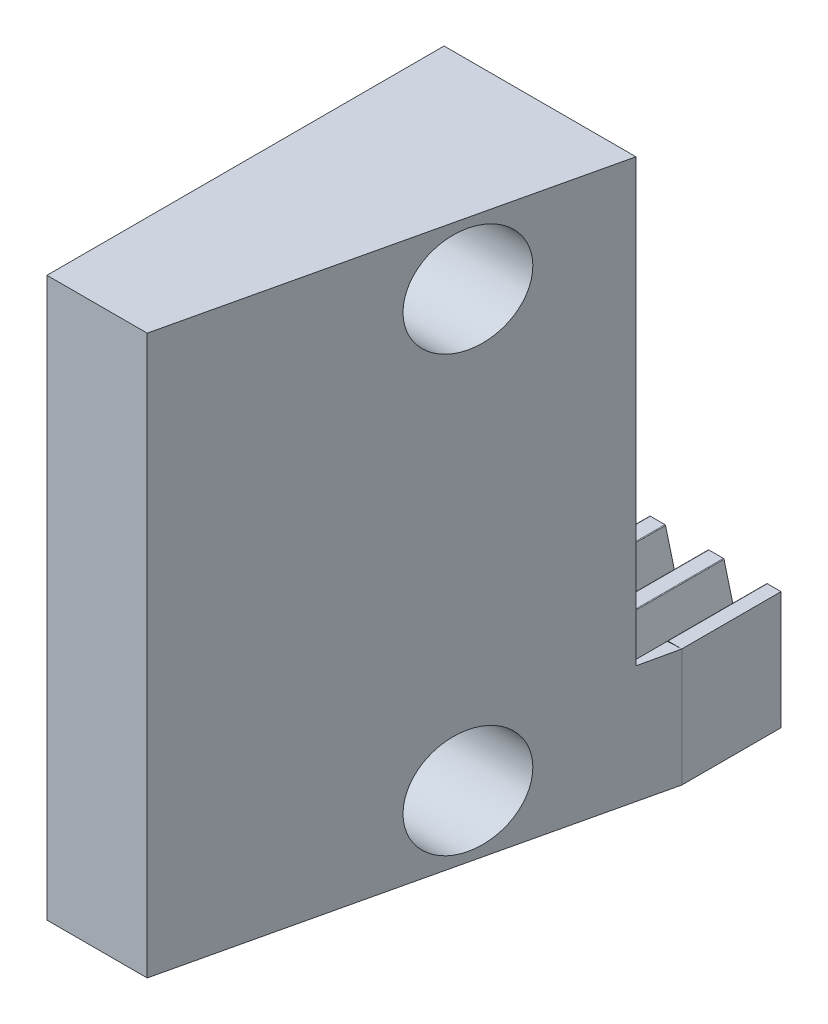
from build123d import *

# Parameters (mm, degrees)
BLANKSKE_W          = 50
BLANKSKE_H          = 9.5
BLANK_DEPTH         = 8
TOOTHCUTILL_DEPTH   = 52.519413817
TOOTHCUTSIM_DEPTH   = 52.519413817
TEETHCUTS_COUNT     = 12
TEETHCUTS_PITCH     = 4.712388975
BOSS_EXTRUDE8_DEPTH = 45
CUT_EXTRUDE5_DEPTH  = 3
SKETCH20_R          = 4.25
CUT_EXTRUDE6_DEPTH  = 25


with BuildPart() as part:
    # BlankSke → Blank (new body)
    with BuildSketch(Plane.XY):
        with Locations((25, 4.75)):
            Rectangle(BLANKSKE_W, BLANKSKE_H)
    extrude(amount=-BLANK_DEPTH)

    # TooCutSkeIll → ToothCutIll (cut, through all)
    with BuildSketch(Plane.XY):
        with BuildLine():
            Line((-1.713391726, 9.4550228), (-0.92508248, 6.406857118))
            ThreePointArc((-0.92508248, 6.406857118), (-0.791252665, 6.20370072), (-0.561058967, 6.125))
            Line((-0.561058967, 6.125), (0.561058967, 6.125))
            ThreePointArc((0.561058967, 6.125), (0.791252665, 6.20370072), (0.92508248, 6.406857118))
            Line((0.92508248, 6.406857118), (1.713391726, 9.4550228))
            ThreePointArc((1.713391726, 9.4550228), (1.734747547, 9.487441374), (1.771480584, 9.5))
            Line((1.771480584, 9.5), (1.771480584, 9.5254))
            Line((1.771480584, 9.5254), (-1.771480584, 9.5254))
            Line((-1.771480584, 9.5254), (-1.771480584, 9.5))
            ThreePointArc((-1.771480584, 9.5), (-1.734747547, 9.487441374), (-1.713391726, 9.4550228))
        make_face()
    toothcutill = extrude(amount=-TOOTHCUTILL_DEPTH, mode=Mode.SUBTRACT)

    # TooCutSkeSim → ToothCutSim (cut, through all)
    with BuildSketch(Plane.XY):
        Polygon((0.852189273, 6.125), (-0.852189273, 6.125), (-1.731592507, 9.5254), (1.731592507, 9.5254), align=None)
    toothcutsim = extrude(amount=-TOOTHCUTSIM_DEPTH, mode=Mode.SUBTRACT)

    # TeethCuts: ToothCutIll, ToothCutSim ×12
    with Locations(*[(i * TEETHCUTS_PITCH, 0, 0) for i in range(1, TEETHCUTS_COUNT)]):
        add(toothcutill, mode=Mode.SUBTRACT)
        add(toothcutsim, mode=Mode.SUBTRACT)

    # Sketch16 → Boss-Extrude8 (add)
    with BuildSketch(Plane.XZ):
        Polygon((50, 0), (33.849, 0), (33.849, 35), (41.925, 35), align=None)
    extrude(amount=-BOSS_EXTRUDE8_DEPTH)

    # Sketch17 → Cut-Extrude5 (cut)
    with BuildSketch(Plane(origin=(0, 0, 0), x_dir=(-1, 0, 0), z_dir=(0, 0, -1))):
        Polygon((-50, 9.5), (-48.837281476, 9.4550228), (-47.976079023, 6.125), (-46.271700477, 6.125), (-45.410498024, 9.4550228), (-44.124892501, 9.4550228), (-43.263690048, 6.125), (-41.559311502, 6.125), (-40.698109049, 9.4550228), (-39.412503526, 9.4550228), (-38.551301073, 6.125), (-36.846922527, 6.125), (-35.985720074, 9.4550228), (-34.700114551, 9.4550228), (-33.838912098, 6.125), (-33.849, 45), (-50, 45), align=None)
    extrude(amount=-CUT_EXTRUDE5_DEPTH, mode=Mode.SUBTRACT)

    # Sketch20 → Cut-Extrude6 (cut)
    with BuildSketch(Plane.ZY.offset(-33.849)):
        with Locations((14, 40)):
            Circle(SKETCH20_R)
        with Locations((14, 5)):
            Circle(SKETCH20_R)
    extrude(amount=-CUT_EXTRUDE6_DEPTH, mode=Mode.SUBTRACT)


solid = part.part
